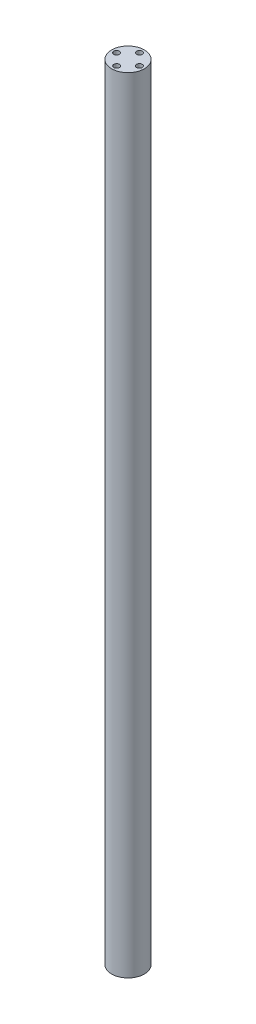
from build123d import *

# Parameters (mm, degrees)
SKETCH1_R           = 12.7
BOSS_EXTRUDE1_DEPTH = 609.6
SKETCH2_R           = 3.96875
CUT_EXTRUDE1_DEPTH  = 76.2
SKETCH3_R           = 2.1971
CUT_EXTRUDE2_DEPTH  = 76.2


with BuildPart() as part:
    # Sketch1 → Boss-Extrude1 (new body)
    with BuildSketch(Plane(origin=(0, 0, 0), x_dir=(1, 0, 0), z_dir=(0, 1, 0))):
        Circle(SKETCH1_R)
    extrude(amount=BOSS_EXTRUDE1_DEPTH)

    # Sketch2 → Cut-Extrude1 (cut)
    with BuildSketch(Plane.XZ):
        Circle(SKETCH2_R)
    extrude(amount=-CUT_EXTRUDE1_DEPTH, mode=Mode.SUBTRACT)

    # Sketch3 → Cut-Extrude2 (cut)
    with BuildSketch(Plane(origin=(0, 609.6, 0), x_dir=(1, 0, 0), z_dir=(0, 1, 0))):
        with Locations((0, 8.89)):
            Circle(SKETCH3_R)
        with Locations((8.89, 0)):
            Circle(SKETCH3_R)
        with Locations((0, -8.89)):
            Circle(SKETCH3_R)
        with Locations((-8.89, 0)):
            Circle(SKETCH3_R)
    extrude(amount=-CUT_EXTRUDE2_DEPTH, mode=Mode.SUBTRACT)


solid = part.part
